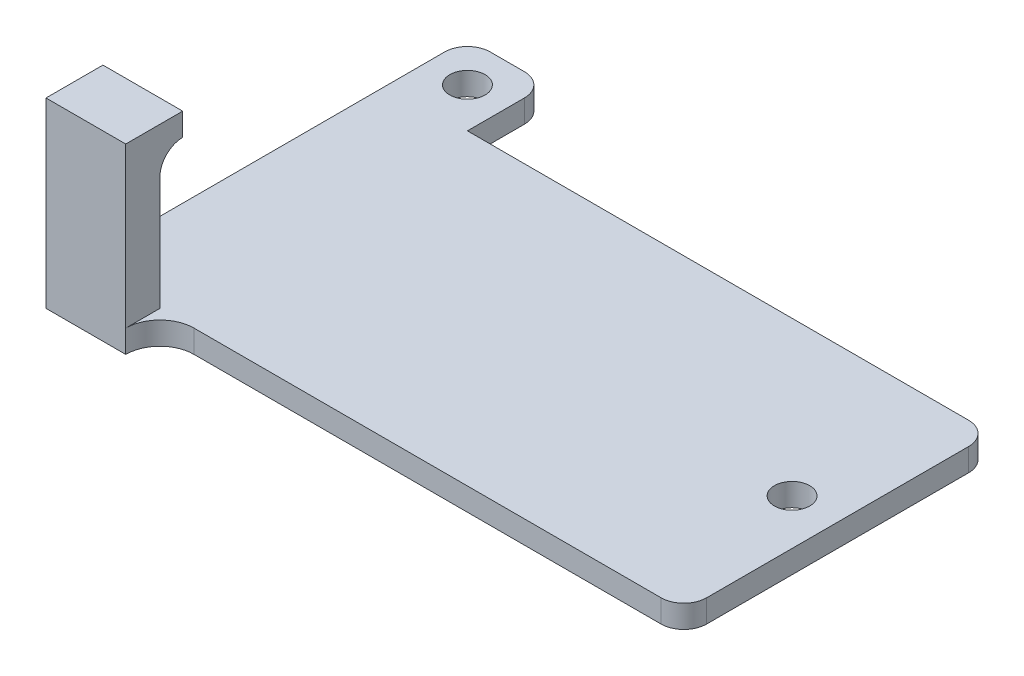
from build123d import *

# Parameters (mm, degrees)
ESBO_O1_W                = 7
ESBO_O1_H                = 3
ESBO_O1_W_2              = 53
ESBO_O1_H_2              = 27
ESBO_O1_H_3              = 7
ESBO_O1_R                = 1.55
RESSALTO_EXTRUS_O1_DEPTH = 2
ESBO_O2_W                = 7
ESBO_O2_H                = 3
RESSALTO_EXTRUS_O2_DEPTH = 14
ESBO_O3_W                = 7
ESBO_O3_H                = 2
RESSALTO_EXTRUS_O3_DEPTH = 2
FILETE1_R                = 2
FILETE2_R                = 3
ESBO_O4_R                = 1.55
CORTE_EXTRUS_O1_DEPTH    = 2
FILETE3_R                = 2


with BuildPart() as part:
    # Esboço1 → Ressalto-extrusão1 (new body)
    # profile 1 of 3: a face of its own
    with BuildSketch(Plane(origin=(0, 0, 0), x_dir=(1, 0, 0), z_dir=(0, 1, 0))):
        with Locations((-23, -15)):
            Rectangle(ESBO_O1_W, ESBO_O1_H)
    # profile 2 of 3: a face of its own
    with BuildSketch(Plane(origin=(0, 0, 0), x_dir=(1, 0, 0), z_dir=(0, 1, 0))):
        Rectangle(ESBO_O1_W_2, ESBO_O1_H_2)
    # profile 3 of 3: a face of its own
    with BuildSketch(Plane(origin=(0, 0, 0), x_dir=(1, 0, 0), z_dir=(0, 1, 0))):
        with Locations((-23, 17)):
            Rectangle(ESBO_O1_W, ESBO_O1_H_3)
        with Locations(Location((-23, 17, 0), (0, 0, 270))):
            Circle(ESBO_O1_R, mode=Mode.SUBTRACT)
    extrude(amount=-RESSALTO_EXTRUS_O1_DEPTH)

    # Esboço2 → Ressalto-extrusão2 (add)
    with BuildSketch(Plane(origin=(0, 0, 0), x_dir=(1, 0, 0), z_dir=(0, 1, 0))):
        with Locations((-23, -15)):
            Rectangle(ESBO_O2_W, ESBO_O2_H)
    extrude(amount=RESSALTO_EXTRUS_O2_DEPTH)

    # Esboço3 → Ressalto-extrusão3 (add)
    with BuildSketch(Plane(origin=(0, 0, 13.5), x_dir=(-1, 0, 0), z_dir=(0, 0, -1))):
        with Locations((23, 13)):
            Rectangle(ESBO_O3_W, ESBO_O3_H)
    extrude(amount=RESSALTO_EXTRUS_O3_DEPTH)

    # Filete1
    filete1_edges = [part.edges().sort_by_distance(p)[0] for p in [
        (-23, 12, 13.5),
    ]]
    fillet(filete1_edges, radius=FILETE1_R - 0.0001)  # a hair under: the kernel refuses the full size

    # Filete2
    filete2_edges = [part.edges().sort_by_distance(p)[0] for p in [
        (-19.5, -1, 13.5),
    ]]
    fillet(filete2_edges, radius=FILETE2_R - 0.0001)  # a hair under: the kernel refuses the full size

    # Esboço4 → Corte-extrusão1 (cut)
    with BuildSketch(Plane(origin=(0, 0, 0), x_dir=(1, 0, 0), z_dir=(0, 1, 0))):
        with Locations(Location((22.5, 0, 0), (0, 0, 270))):
            Circle(ESBO_O4_R)
    extrude(amount=-CORTE_EXTRUS_O1_DEPTH, mode=Mode.SUBTRACT)

    # Filete3
    filete3_edges = [part.edges().sort_by_distance(p)[0] for p in [
        (-26.5, -1, -20.5),
        (-19.5, -1, -20.5),
        (26.5, -1, -13.5),
        (26.5, -1, 13.5),
    ]]
    fillet(filete3_edges, radius=FILETE3_R)


solid = part.part
